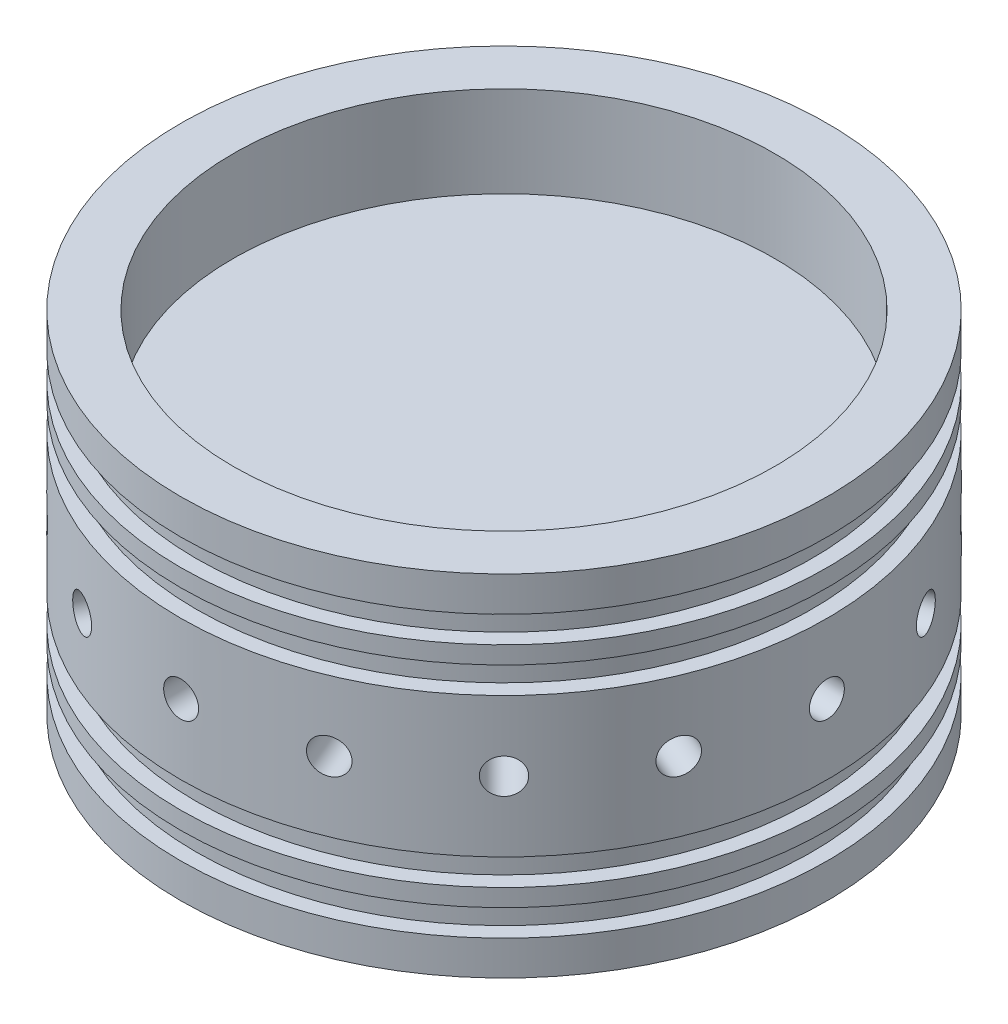
from build123d import *

# Parameters (mm, degrees)
HOLEPATTERN_COUNT = 16


with BuildPart() as part:
    # Sketch1 → Revolve1 (revolve)
    with BuildSketch(Plane.XY):
        Polygon((0, -15.24), (0, 15.3162), (-49.2125, 15.3162), (-49.2125, 31.8262), (-58.7375, 31.8262), (-58.7375, 25.4762), (-55.9181, 25.4762), (-55.9181, 20.6756), (-58.7375, 20.6756), (-58.7375, 17.5006), (-55.9181, 17.5006), (-55.9181, 12.7), (-58.7375, 12.7), (-58.7375, -12.7), (-55.9435, -12.7), (-55.9435, -17.5006), (-58.7375, -17.5006), (-58.7375, -20.6756), (-55.9435, -20.6756), (-55.9435, -25.4762), (-58.7375, -25.4762), (-58.7375, -31.75), (-49.2125, -31.75), (-49.2125, -15.24), align=None)
    revolve(axis=Axis((0, 31.75, 0), (0, -1, 0)))

    # Sketch4 → 1/4 (0.25) Diameter Hole1 (revolve, cut)
    with BuildSketch(Plane(origin=(0, 0, 58.7375), x_dir=(0, -1, 0), z_dir=(1, 0, 0))):
        Polygon((0, 0), (0, 27.307732465), (3.175, 25.4), (3.175, 0), align=None)
    f_1_4_0_25_diameter_hole1 = revolve(axis=Axis((0, 0, 65.0875), (0, 0, -1)), mode=Mode.SUBTRACT)

    # HolePattern: 1/4 (0.25) Diameter Hole1 ×16 about axis
    holepattern_axis = Axis((0, -12.7, 0), (0, 1, 0))
    for i in range(1, HOLEPATTERN_COUNT):
        add(f_1_4_0_25_diameter_hole1.rotate(holepattern_axis, i * 360 / HOLEPATTERN_COUNT), mode=Mode.SUBTRACT)


solid = part.part
